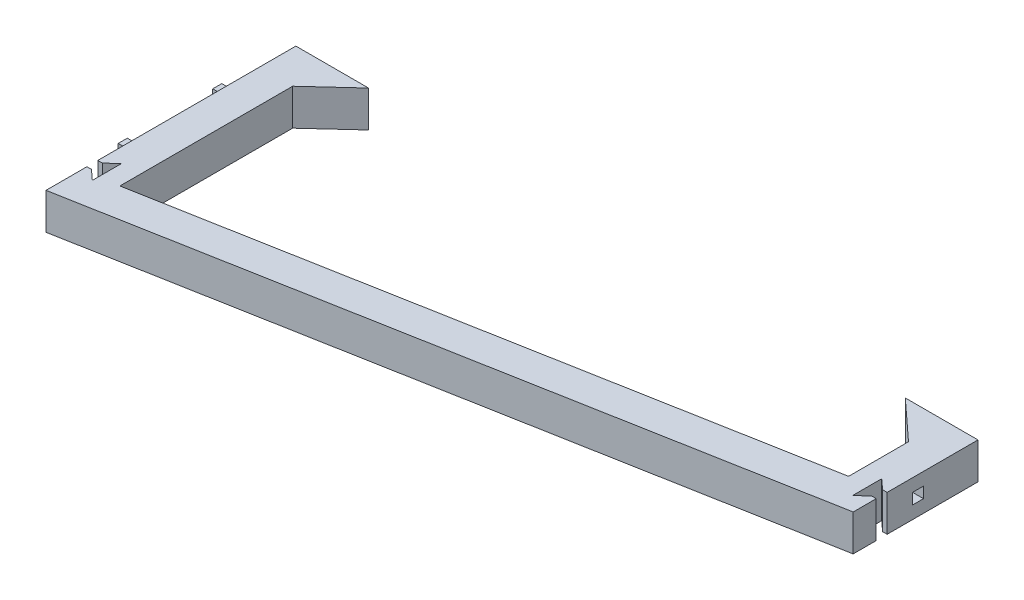
from build123d import *

# Parameters (mm, degrees)
P_IDAT_VYSUNUT_M1_DEPTH  = 8
ODEBRAT_VYSUNUT_M1_DEPTH = 161.106285011
SKICA3_W                 = 2
SKICA3_H                 = 2
P_IDAT_VYSUNUT_M2_DEPTH  = 4
SKICA5_W                 = 16
SKICA5_H                 = 8
P_IDAT_VYSUNUT_M3_DEPTH  = 8
ODEBRAT_VYSUNUT_M4_DEPTH = 161.106285011
SKICA4_W                 = 2.4
SKICA4_H                 = 2.4
ODEBRAT_VYSUNUT_M2_DEPTH = 4.4
ODEBRAT_VYSUNUT_M5_DEPTH = 161.106285011
SKICA11_R                = 2.2
ODEBRAT_VYSUNUT_M7_DEPTH = 9.4


with BuildPart() as part:
    # Skica1 → Přidat vysunutím1 (new body)
    with BuildSketch(Plane(origin=(0, 0, 0), x_dir=(1, 0, 0), z_dir=(0, 1, 0))):
        Polygon((0, 0), (0, -55), (150.15, -27.472114866), (150.15, 0), (142.85, 0), (142.85, -21.185463454), (7.3, -46.036644473), (7.3, 0), align=None)
    extrude(amount=P_IDAT_VYSUNUT_M1_DEPTH)

    # Skica2 → Odebrat vysunutím1 (cut, through all)
    with BuildSketch(Plane(origin=(0, 8, 0), x_dir=(1, 0, 0), z_dir=(0, 1, 0))):
        Polygon((0, -43.6), (1, -43.6), (3.2, -41.6), (3.2, -48), (1, -46), (0, -46), align=None)
    extrude(amount=-ODEBRAT_VYSUNUT_M1_DEPTH, mode=Mode.SUBTRACT)

    # Skica3 → Přidat vysunutím2 (add)
    with BuildSketch(Plane.ZY):
        with Locations((13.3, 4)):
            Rectangle(SKICA3_W, SKICA3_H)
        with Locations((34.1, 4)):
            Rectangle(SKICA3_W, SKICA3_H)
    extrude(amount=P_IDAT_VYSUNUT_M2_DEPTH)

    # Skica5 → Přidat vysunutím3 (add)
    with BuildSketch(Plane(origin=(0, 8, 0), x_dir=(1, 0, 0), z_dir=(0, 1, 0))):
        with Locations((8, -4)):
            Rectangle(SKICA5_W, SKICA5_H)
        with Locations((142.15, -4)):
            Rectangle(SKICA5_W, SKICA5_H)
    extrude(amount=-P_IDAT_VYSUNUT_M3_DEPTH)

    # Skica7 → Odebrat vysunutím4 (cut, through all)
    with BuildSketch(Plane.XZ):
        Polygon((7.3, 8), (16, 0), (16, 8), align=None)
        Polygon((134.15, 0), (134.15, 8), (142.85, 8), align=None)
    extrude(amount=-ODEBRAT_VYSUNUT_M4_DEPTH, mode=Mode.SUBTRACT)

    # Skica4 → Odebrat vysunutím2 (cut)
    with BuildSketch(Plane(origin=(150.15, 0, 0), x_dir=(0, 0, -1), z_dir=(1, 0, 0))):
        with Locations((-13.2, 4)):
            Rectangle(SKICA4_W, SKICA4_H)
    extrude(amount=-ODEBRAT_VYSUNUT_M2_DEPTH, mode=Mode.SUBTRACT)

    # Skica8 → Odebrat vysunutím5 (cut, through all)
    with BuildSketch(Plane(origin=(0, 8, 0), x_dir=(1, 0, 0), z_dir=(0, 1, 0))):
        Polygon((150.15, -20), (149.15, -20), (146.95, -18), (146.95, -24.4), (149.15, -22.4), (150.15, -22.4), align=None)
    extrude(amount=-ODEBRAT_VYSUNUT_M5_DEPTH, mode=Mode.SUBTRACT)

    # Skica11 → Odebrat vysunutím7 (cut)
    with BuildSketch(Plane(origin=(0, 0, 0), x_dir=(-1, 0, 0), z_dir=(0, 0, -1))):
        with Locations((-146.5, 4)):
            Circle(SKICA11_R)
        with Locations((-3.65, 4)):
            Circle(SKICA11_R)
    extrude(amount=-ODEBRAT_VYSUNUT_M7_DEPTH, mode=Mode.SUBTRACT)


solid = part.part
